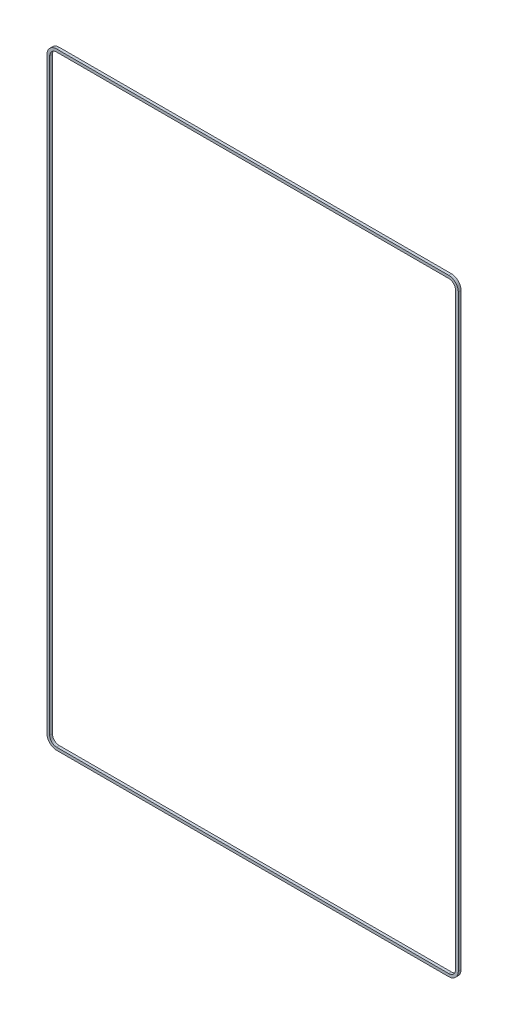
from build123d import *

# Parameters (mm, degrees)
BOSS_EXTRUDE1_DEPTH = 1.778


with BuildPart() as part:
    # Sketch1 → Boss-Extrude1 (new body)
    with BuildSketch(Plane.XY):
        with BuildLine():
            Line((-1.905, 385.318), (-1.905, 4.318))
            ThreePointArc((-1.905, 4.318), (-0.082325499, -0.082325499), (4.318, -1.905))
            Line((4.318, -1.905), (258.318, -1.905))
            ThreePointArc((258.318, -1.905), (262.718325499, -0.082325499), (264.541, 4.318))
            Line((264.541, 4.318), (264.541, 385.318))
            ThreePointArc((264.541, 385.318), (262.718325499, 389.718325499), (258.318, 391.541))
            Line((258.318, 391.541), (4.318, 391.541))
            ThreePointArc((4.318, 391.541), (-0.082325499, 389.718325499), (-1.905, 385.318))
        make_face()
        with BuildLine():
            ThreePointArc((4.318, -0.127), (1.174910358, 1.174910358), (-0.127, 4.318))
            Line((-0.127, 4.318), (-0.127, 385.318))
            ThreePointArc((-0.127, 385.318), (1.174910358, 388.461089642), (4.318, 389.763))
            Line((4.318, 389.763), (258.318, 389.763))
            ThreePointArc((258.318, 389.763), (261.461089642, 388.461089642), (262.763, 385.318))
            Line((262.763, 385.318), (262.763, 4.318))
            ThreePointArc((262.763, 4.318), (261.461089642, 1.174910358), (258.318, -0.127))
            Line((258.318, -0.127), (4.318, -0.127))
        make_face(mode=Mode.SUBTRACT)
    extrude(amount=BOSS_EXTRUDE1_DEPTH)


solid = part.part
